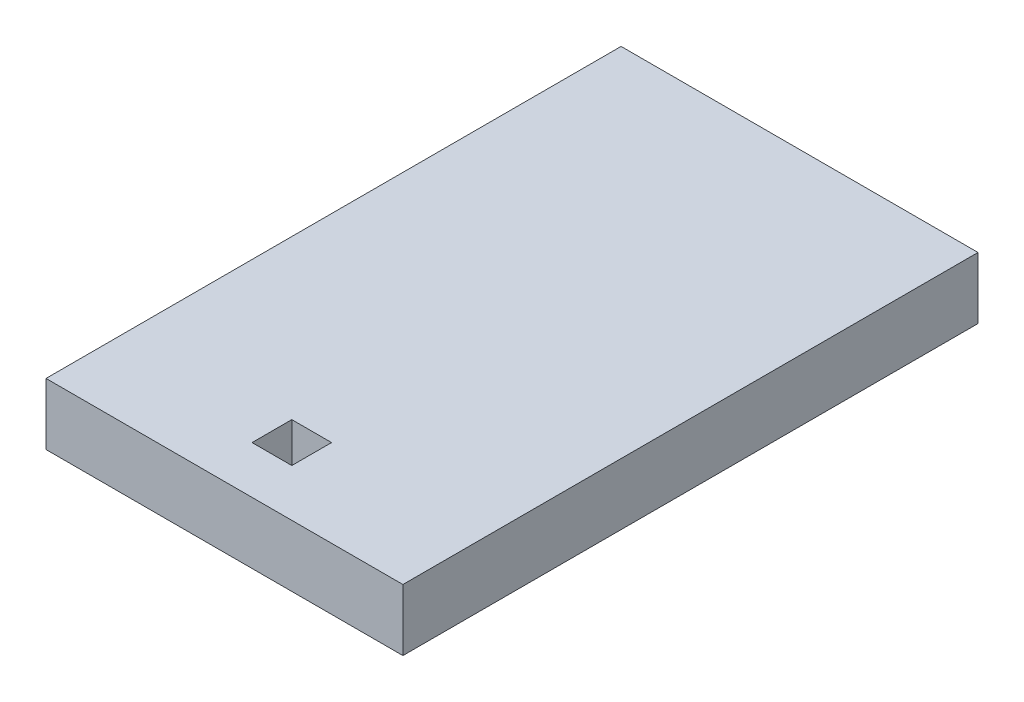
from build123d import *

# Parameters (mm, degrees)
SKETCH1_W           = 21.575
SKETCH1_H           = 29.6472
SKETCH1_W_2         = 2.05
SKETCH1_H_2         = 2.05
BOSS_EXTRUDE1_DEPTH = 3.175
SKETCH2_W           = 3.175
SKETCH2_H           = 29.6472
CUT_EXTRUDE1_DEPTH  = 20.569373188


with BuildPart() as part:
    # Sketch1 → Boss-Extrude1 (new body)
    with BuildSketch(Plane(origin=(0, 0, 0), x_dir=(1, 0, 0), z_dir=(0, 1, 0))):
        with Locations((-1.5875, 0)):
            Rectangle(SKETCH1_W, SKETCH1_H)
        with Locations((0, -11.3514)):
            Rectangle(SKETCH1_W_2, SKETCH1_H_2, mode=Mode.SUBTRACT)
    extrude(amount=BOSS_EXTRUDE1_DEPTH)

    # Sketch2 → Cut-Extrude1 (cut, through all)
    with BuildSketch(Plane(origin=(0, 3.175, 0), x_dir=(1, 0, 0), z_dir=(0, 1, 0))):
        with Locations((-10.7875, 0)):
            Rectangle(SKETCH2_W, SKETCH2_H)
    extrude(amount=-CUT_EXTRUDE1_DEPTH, mode=Mode.SUBTRACT)


solid = part.part
